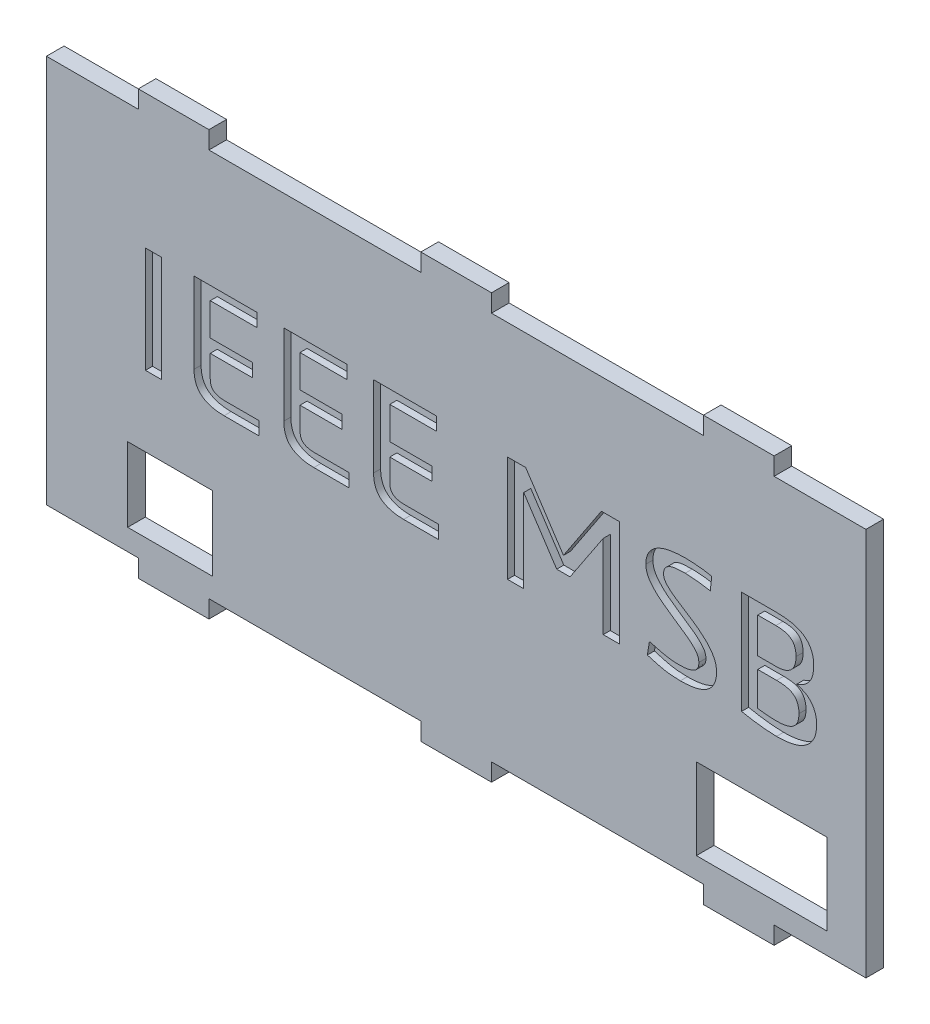
from build123d import *

# Parameters (mm, degrees)
SKETCH1_W           = 12
SKETCH1_H           = 10.5
SKETCH1_W_2         = 18.5
SKETCH1_H_2         = 11.5
BOSS_EXTRUDE1_DEPTH = 2.5
SKETCH2_W           = 2.291666667
SKETCH2_H           = 15
CUT_EXTRUDE1_DEPTH  = 1


with BuildPart() as part:
    # Sketch1 → Boss-Extrude1 (new body)
    with BuildSketch(Plane.XY):
        Polygon((-45, -30), (-35, -30), (-35, -27.5), (-5, -27.5), (-5, -30), (5, -30), (5, -27.5), (35, -27.5), (35, -30), (45, -30), (45, -27.5), (58, -27.5), (58, 27.5), (45, 27.5), (45, 30), (35, 30), (35, 27.5), (5, 27.5), (5, 30), (-5, 30), (-5, 27.5), (-35, 27.5), (-35, 30), (-45, 30), (-45, 27.5), (-58, 27.5), (-58, -27.5), (-45, -27.5), align=None)
        with Locations((-40.5, -19.25)):
            Rectangle(SKETCH1_W, SKETCH1_H, mode=Mode.SUBTRACT)
        with Locations((43.25, -18.75)):
            Rectangle(SKETCH1_W_2, SKETCH1_H_2, mode=Mode.SUBTRACT)
    extrude(amount=BOSS_EXTRUDE1_DEPTH)

    # Sketch2 → Cut-Extrude1 (cut)
    # profile 1 of 7: a face of its own
    with BuildSketch(Plane.XY.offset(2.5)):
        with Locations((-42.833333334, 3.5)):
            Rectangle(SKETCH2_W, SKETCH2_H)
    # profile 2 of 7: a face of its own
    with BuildSketch(Plane.XY.offset(2.5)):
        with BuildLine():
            Line((-28.194661458, 11), (-28.194661458, 9.125))
            Line((-28.194661458, 9.125), (-34.8125, 9.125))
            Line((-34.8125, 9.125), (-34.8125, 4.541666667))
            Line((-34.8125, 4.541666667), (-28.848958333, 4.541666667))
            Line((-28.848958333, 4.541666667), (-28.848958333, 2.666666667))
            Line((-28.848958333, 2.666666667), (-34.8125, 2.666666667))
            Line((-34.8125, 2.666666667), (-34.8125, -0.442057292))
            add(Edge.make_bspline(
                [(-34.8125, -0.442057292), (-34.810499584, -0.518088856), (-34.80662934, -0.66518864), (-34.780663549, -0.876603942), (-34.738954286, -1.069780939), (-34.680649072, -1.245349161), (-34.602636, -1.402028067), (-34.506532411, -1.540476285), (-34.395864041, -1.663673392), (-34.21662039, -1.798822172), (-33.95558579, -1.931839396), (-33.600741463, -2.046173424), (-33.198266319, -2.113369845), (-32.913891383, -2.121002854), (-32.764973958, -2.125)],
                knots=[0, 0, 0, 0, 0.897147799, 1.735729735, 2.509325195, 3.226042148, 3.913211409, 4.56675016, 5.210175516, 5.858171432, 7.204182463, 8.645714609, 10.243475498, 12, 12, 12, 12], degree=3))
            Line((-32.764973958, -2.125), (-27.904947917, -2.125))
            Line((-27.904947917, -2.125), (-27.904947917, -4))
            Line((-27.904947917, -4), (-32.852864583, -4))
            add(Edge.make_bspline(
                [(-32.852864583, -4), (-33.016773774, -3.997544016), (-33.335317899, -3.992771013), (-33.799986275, -3.954577847), (-34.235439235, -3.884766944), (-34.644890307, -3.796890155), (-35.022670985, -3.674410018), (-35.375187051, -3.53252437), (-35.697577169, -3.359187639), (-35.993313294, -3.161218378), (-36.256648285, -2.93117775), (-36.485869651, -2.670550433), (-36.677326863, -2.374947251), (-36.832074749, -2.048056487), (-36.957271456, -1.690519573), (-37.04357224, -1.300511014), (-37.096410836, -0.878634497), (-37.101523743, -0.586536108), (-37.104166667, -0.435546875)],
                knots=[0, 0, 0, 0, 1.238103223, 2.406152487, 3.517886997, 4.567837051, 5.565824166, 6.514104558, 7.434522606, 8.325680568, 9.196978744, 10.068276919, 10.938996607, 11.84817843, 12.79433104, 13.794503591, 14.859951901, 16, 16, 16, 16], degree=3))
            Line((-37.104166667, -0.435546875), (-37.104166667, 11))
            Line((-37.104166667, 11), (-28.194661458, 11))
        make_face()
    # profile 3 of 7: a face of its own
    with BuildSketch(Plane.XY.offset(2.5)):
        with BuildLine():
            Line((-15.486328125, 11), (-15.486328125, 9.125))
            Line((-15.486328125, 9.125), (-22.104166667, 9.125))
            Line((-22.104166667, 9.125), (-22.104166667, 4.541666667))
            Line((-22.104166667, 4.541666667), (-16.140625, 4.541666667))
            Line((-16.140625, 4.541666667), (-16.140625, 2.666666667))
            Line((-16.140625, 2.666666667), (-22.104166667, 2.666666667))
            Line((-22.104166667, 2.666666667), (-22.104166667, -0.442057292))
            add(Edge.make_bspline(
                [(-22.104166667, -0.442057292), (-22.102166251, -0.518088856), (-22.098296007, -0.66518864), (-22.072330216, -0.876603942), (-22.030620953, -1.069780939), (-21.972315739, -1.245349161), (-21.894302667, -1.402028067), (-21.798199078, -1.540476285), (-21.687530708, -1.663673392), (-21.508287056, -1.798822172), (-21.247252457, -1.931839396), (-20.892408129, -2.046173424), (-20.489932986, -2.113369845), (-20.20555805, -2.121002854), (-20.056640625, -2.125)],
                knots=[0, 0, 0, 0, 0.897147799, 1.735729735, 2.509325195, 3.226042148, 3.913211409, 4.56675016, 5.210175516, 5.858171432, 7.204182463, 8.645714609, 10.243475498, 12, 12, 12, 12], degree=3))
            Line((-20.056640625, -2.125), (-15.196614583, -2.125))
            Line((-15.196614583, -2.125), (-15.196614583, -4))
            Line((-15.196614583, -4), (-20.14453125, -4))
            add(Edge.make_bspline(
                [(-20.14453125, -4), (-20.308440441, -3.997544016), (-20.626984566, -3.992771013), (-21.091652942, -3.954577847), (-21.527105901, -3.884766944), (-21.936556974, -3.796890155), (-22.314337652, -3.674410018), (-22.666853718, -3.53252437), (-22.989243836, -3.359187639), (-23.284979961, -3.161218378), (-23.548314952, -2.93117775), (-23.777536318, -2.670550433), (-23.968993529, -2.374947251), (-24.123741416, -2.048056487), (-24.248938122, -1.690519573), (-24.335238906, -1.300511014), (-24.388077503, -0.878634497), (-24.393190409, -0.586536108), (-24.395833333, -0.435546875)],
                knots=[0, 0, 0, 0, 1.238103223, 2.406152487, 3.517886997, 4.567837051, 5.565824166, 6.514104558, 7.434522606, 8.325680568, 9.196978744, 10.068276919, 10.938996607, 11.84817843, 12.79433104, 13.794503591, 14.859951901, 16, 16, 16, 16], degree=3))
            Line((-24.395833333, -0.435546875), (-24.395833333, 11))
            Line((-24.395833333, 11), (-15.486328125, 11))
        make_face()
    # profile 4 of 7: a face of its own
    with BuildSketch(Plane.XY.offset(2.5)):
        with BuildLine():
            Line((-2.777994792, 11), (-2.777994792, 9.125))
            Line((-2.777994792, 9.125), (-9.395833333, 9.125))
            Line((-9.395833333, 9.125), (-9.395833333, 4.541666667))
            Line((-9.395833333, 4.541666667), (-3.432291667, 4.541666667))
            Line((-3.432291667, 4.541666667), (-3.432291667, 2.666666667))
            Line((-3.432291667, 2.666666667), (-9.395833333, 2.666666667))
            Line((-9.395833333, 2.666666667), (-9.395833333, -0.442057292))
            add(Edge.make_bspline(
                [(-9.395833333, -0.442057292), (-9.393832918, -0.518088856), (-9.389962674, -0.66518864), (-9.363996882, -0.876603942), (-9.32228762, -1.069780939), (-9.263982405, -1.245349161), (-9.185969333, -1.402028067), (-9.089865744, -1.540476285), (-8.979197375, -1.663673392), (-8.799953723, -1.798822172), (-8.538919124, -1.931839396), (-8.184074796, -2.046173424), (-7.781599653, -2.113369845), (-7.497224717, -2.121002854), (-7.348307292, -2.125)],
                knots=[0, 0, 0, 0, 0.897147799, 1.735729735, 2.509325195, 3.226042148, 3.913211409, 4.56675016, 5.210175516, 5.858171432, 7.204182463, 8.645714609, 10.243475498, 12, 12, 12, 12], degree=3))
            Line((-7.348307292, -2.125), (-2.48828125, -2.125))
            Line((-2.48828125, -2.125), (-2.48828125, -4))
            Line((-2.48828125, -4), (-7.436197917, -4))
            add(Edge.make_bspline(
                [(-7.436197917, -4), (-7.600107108, -3.997544016), (-7.918651232, -3.992771013), (-8.383319608, -3.954577847), (-8.818772568, -3.884766944), (-9.228223641, -3.796890155), (-9.606004319, -3.674410018), (-9.958520385, -3.53252437), (-10.280910502, -3.359187639), (-10.576646627, -3.161218378), (-10.839981618, -2.93117775), (-11.069202984, -2.670550433), (-11.260660196, -2.374947251), (-11.415408082, -2.048056487), (-11.540604789, -1.690519573), (-11.626905573, -1.300511014), (-11.67974417, -0.878634497), (-11.684857076, -0.586536108), (-11.6875, -0.435546875)],
                knots=[0, 0, 0, 0, 1.238103223, 2.406152487, 3.517886997, 4.567837051, 5.565824166, 6.514104558, 7.434522606, 8.325680568, 9.196978744, 10.068276919, 10.938996607, 11.84817843, 12.79433104, 13.794503591, 14.859951901, 16, 16, 16, 16], degree=3))
            Line((-11.6875, -0.435546875), (-11.6875, 11))
            Line((-11.6875, 11), (-2.777994792, 11))
        make_face()
    # profile 5 of 7: a face of its own
    with BuildSketch(Plane.XY.offset(2.5)):
        Polygon((9.842447917, 11), (15.1875, 2.901041667), (20.555338542, 11), (23.104166667, 11), (23.104166667, -4), (20.8125, -4), (20.8125, 7.796875), (16.118489583, 0.733072917), (14.233723958, 0.733072917), (9.5625, 7.796875), (9.5625, -4), (7.270833333, -4), (7.270833333, 11), align=None)
    # profile 6 of 7: a face of its own
    with BuildSketch(Plane.XY.offset(2.5)):
        with BuildLine():
            add(Edge.make_bspline(
                [(35.96875, 8.94921875), (35.847382499, 8.972939527), (35.585925852, 9.024040149), (35.169264003, 9.084231487), (34.717233417, 9.150496911), (34.244919389, 9.207151413), (33.764575384, 9.26140463), (33.290052344, 9.297900239), (32.83973213, 9.326328395), (32.550819065, 9.331082829), (32.4140625, 9.333333333)],
                knots=[0, 0, 0, 0, 0.829036243, 1.785956155, 2.822045536, 3.89228551, 4.975307857, 6.062841547, 7.083048955, 8, 8, 8, 8], degree=3))
            add(Edge.make_bspline(
                [(32.4140625, 9.333333333), (32.199183815, 9.331012657), (31.786327552, 9.326553835), (31.28309883, 9.293825898), (30.911256435, 9.244948734), (30.657538538, 9.199515352), (30.425508425, 9.128971154), (30.212423744, 9.048419264), (30.018729418, 8.953034686), (29.850019744, 8.831704342), (29.700103959, 8.69718945), (29.573887231, 8.541776869), (29.474690145, 8.36589022), (29.402261882, 8.167248908), (29.360209969, 7.944041658), (29.356235032, 7.787293409), (29.354166667, 7.705729167)],
                knots=[0, 0, 0, 0, 2.295489194, 4.410428573, 5.380894891, 6.301560079, 7.159764947, 7.966985716, 8.734184816, 9.457764993, 10.179765198, 10.880326743, 11.586237622, 12.32697511, 13.129438398, 14, 14, 14, 14], degree=3))
            add(Edge.make_bspline(
                [(29.354166667, 7.705729167), (29.361409468, 7.605005926), (29.376118975, 7.400445675), (29.488629947, 7.101368396), (29.665819964, 6.810691817), (29.911097634, 6.531289392), (30.204000994, 6.253994686), (30.538414987, 5.979622485), (30.902328744, 5.697829675), (31.447861052, 5.321604039), (32.186811584, 4.842443132), (33.111865491, 4.255167236), (34.043209124, 3.634444765), (34.772801435, 3.059465589), (35.313410904, 2.573778585), (35.678743368, 2.187278779), (36.010611128, 1.784701725), (36.307583482, 1.365582057), (36.550244164, 0.922952991), (36.731704873, 0.45492648), (36.831940297, -0.040674004), (36.846706755, -0.378707172), (36.854166667, -0.549479167)],
                knots=[0, 0, 0, 0, 0.519213468, 1.054477964, 1.630134935, 2.270161266, 2.967727746, 3.71175636, 4.503051278, 5.34407491, 7.13300234, 9.051150551, 11.003302341, 12.910294161, 13.842483047, 14.754150315, 15.653890787, 16.535313878, 17.40293064, 18.254252337, 19.118060482, 20, 20, 20, 20], degree=3))
            add(Edge.make_bspline(
                [(36.854166667, -0.549479167), (36.850010481, -0.710308216), (36.841966427, -1.021583471), (36.774091043, -1.470156947), (36.656825232, -1.881635704), (36.49247906, -2.254822843), (36.290223204, -2.593943308), (36.044880138, -2.896208503), (35.764847726, -3.168986089), (35.442389326, -3.401950674), (35.0876482, -3.607236234), (34.69435551, -3.77271382), (34.270086873, -3.918583958), (33.810585779, -4.026559046), (33.322906823, -4.105755653), (32.811234286, -4.164092155), (32.275699793, -4.200581421), (31.910649342, -4.205710343), (31.723958333, -4.208333333)],
                knots=[0, 0, 0, 0, 1.075194104, 2.080975546, 3.024934148, 3.928271024, 4.800677613, 5.657461563, 6.524782954, 7.407242198, 8.310928775, 9.259978089, 10.255920614, 11.308444205, 12.411965724, 13.558733007, 14.751507922, 16, 16, 16, 16], degree=3))
            add(Edge.make_bspline(
                [(31.723958333, -4.208333333), (31.49271859, -4.205710333), (31.03939084, -4.200568142), (30.372439233, -4.145297915), (29.731569538, -4.064481806), (29.122750848, -3.940488345), (28.549612072, -3.80351775), (28.015982838, -3.663284471), (27.523893527, -3.524673693), (27.212002358, -3.425698242), (27.0625, -3.378255208)],
                knots=[0, 0, 0, 0, 1.166641361, 2.287110747, 3.375174177, 4.42434953, 5.420457035, 6.34882319, 7.208522552, 8, 8, 8, 8], degree=3))
            Line((27.0625, -3.378255208), (27.352213542, -1.568359375))
            add(Edge.make_bspline(
                [(27.352213542, -1.568359375), (27.497525113, -1.609902248), (27.79848078, -1.695941941), (28.265908755, -1.822897344), (28.766670139, -1.948984452), (29.295302689, -2.081201198), (29.852052636, -2.198490499), (30.43335511, -2.272831053), (31.033996084, -2.324778683), (31.441722476, -2.330449305), (31.649088542, -2.333333333)],
                knots=[0, 0, 0, 0, 0.82784923, 1.714563499, 2.653014331, 3.656340952, 4.699592855, 5.767128945, 6.864381369, 8, 8, 8, 8], degree=3))
            add(Edge.make_bspline(
                [(31.649088542, -2.333333333), (31.836979159, -2.329020843), (32.196620654, -2.320766305), (32.710915631, -2.257022293), (33.172865014, -2.146594595), (33.523656266, -2.01930655), (33.767378623, -1.882819904), (33.927902101, -1.766298899), (34.057582548, -1.623331059), (34.168300512, -1.464601226), (34.252239064, -1.28504633), (34.310879512, -1.085267813), (34.346475988, -0.86758439), (34.351552178, -0.715632504), (34.354166667, -0.637369792)],
                knots=[0, 0, 0, 0, 1.865164993, 3.57011294, 5.132569067, 6.57499646, 7.255114939, 7.901464084, 8.534112646, 9.161604161, 9.81695743, 10.491765748, 11.223185006, 12, 12, 12, 12], degree=3))
            add(Edge.make_bspline(
                [(34.354166667, -0.637369792), (34.34676134, -0.522714063), (34.331878289, -0.292281691), (34.224876195, 0.047620316), (34.049090249, 0.3762764), (33.801811741, 0.689836602), (33.509540136, 0.998534112), (33.17762564, 1.305744295), (32.810497005, 1.611291511), (32.261807062, 2.017098091), (31.525949575, 2.529018518), (30.598587419, 3.131410735), (29.671897736, 3.759742714), (28.935450704, 4.31875263), (28.393945465, 4.791525532), (28.025958821, 5.154340942), (27.696811194, 5.530843674), (27.400416872, 5.912466984), (27.152719096, 6.31411637), (26.980322242, 6.743184453), (26.87516672, 7.195058502), (26.861247273, 7.503338834), (26.854166667, 7.66015625)],
                knots=[0, 0, 0, 0, 0.591380666, 1.188542884, 1.822507787, 2.505918877, 3.243027329, 4.015898054, 4.839248524, 5.707487546, 7.538026587, 9.466039613, 11.415971731, 13.317280673, 14.234172866, 15.125381555, 15.982728632, 16.814024653, 17.618094752, 18.409678073, 19.191027939, 20, 20, 20, 20], degree=3))
            add(Edge.make_bspline(
                [(26.854166667, 7.66015625), (26.860042308, 7.821058674), (26.87139753, 8.132017543), (26.951321774, 8.579286303), (27.093334117, 8.98455136), (27.286320652, 9.350420044), (27.531803457, 9.674110255), (27.813454582, 9.965008742), (28.131071384, 10.225194126), (28.490723647, 10.44648277), (28.884374669, 10.636539161), (29.310949798, 10.800747145), (29.769828366, 10.932531637), (30.259633226, 11.0358377), (30.773039972, 11.11182556), (31.306422466, 11.166074832), (31.854687579, 11.204622237), (32.226277086, 11.207087497), (32.4140625, 11.208333333)],
                knots=[0, 0, 0, 0, 1.03838471, 2.006774832, 2.919286264, 3.799627568, 4.665221273, 5.531947435, 6.40804449, 7.307755042, 8.250508454, 9.225938019, 10.254284747, 11.328399385, 12.454517948, 13.602227205, 14.788268378, 16, 16, 16, 16], degree=3))
            add(Edge.make_bspline(
                [(32.4140625, 11.208333333), (32.583364965, 11.206171732), (32.928663231, 11.20176307), (33.450709349, 11.17443366), (33.974707883, 11.135099832), (34.485813099, 11.089591364), (34.96953662, 11.041235914), (35.414245129, 10.974974268), (35.811431209, 10.90474054), (36.058934512, 10.851970405), (36.173828125, 10.827473958)],
                knots=[0, 0, 0, 0, 1.073469456, 2.189378298, 3.313843796, 4.405133658, 5.442979297, 6.395522168, 7.255184668, 8, 8, 8, 8], degree=3))
            Line((36.173828125, 10.827473958), (35.96875, 8.94921875))
        make_face()
    # profile 7 of 7: a face of its own
    with BuildSketch(Plane.XY.offset(2.5)):
        with BuildLine():
            add(Edge.make_bspline(
                [(45.252604167, 11), (45.453421212, 10.997709492), (45.846767377, 10.993223008), (46.421184198, 10.952122977), (46.967345759, 10.893579956), (47.481068949, 10.800858033), (47.964294805, 10.688583256), (48.406940853, 10.5341883), (48.812547931, 10.353100646), (49.176066224, 10.13370575), (49.500909376, 9.880621184), (49.791190229, 9.597451016), (50.035510648, 9.274340654), (50.244126891, 8.919451401), (50.406982016, 8.525207106), (50.524791536, 8.090216349), (50.591913464, 7.613426363), (50.599988459, 7.281680037), (50.604166667, 7.110026042)],
                knots=[0, 0, 0, 0, 1.275017476, 2.497413668, 3.655529886, 4.761172243, 5.810683038, 6.802155223, 7.733376211, 8.626736769, 9.490922873, 10.343577315, 11.193889908, 12.055407364, 12.951156235, 13.893904713, 14.910252681, 16, 16, 16, 16], degree=3))
            add(Edge.make_bspline(
                [(50.604166667, 7.110026042), (50.602363274, 6.986275454), (50.59887759, 6.747084485), (50.570043008, 6.398859263), (50.517933957, 6.073700654), (50.446880421, 5.769915605), (50.356295444, 5.4885178), (50.24428671, 5.229673542), (50.11665277, 4.990149629), (49.908899495, 4.709335488), (49.61133333, 4.392469992), (49.194881443, 4.069376848), (48.719368415, 3.801287998), (48.373168571, 3.673216891), (48.1953125, 3.607421875)],
                knots=[0, 0, 0, 0, 0.966624788, 1.868337948, 2.726741993, 3.536787614, 4.303406302, 5.032411389, 5.737978016, 6.417875256, 7.755106372, 9.120016348, 10.520442492, 12, 12, 12, 12], degree=3))
            add(Edge.make_bspline(
                [(48.1953125, 3.607421875), (48.375846164, 3.557556177), (48.740211622, 3.456913794), (49.173511914, 3.26376819), (49.509671093, 3.084002515), (49.746239638, 2.926048353), (49.963587311, 2.743041203), (50.166398762, 2.542445164), (50.348765952, 2.315173294), (50.515589549, 2.067598345), (50.6628224, 1.795127646), (50.789008558, 1.498782942), (50.895807456, 1.176350661), (50.969301171, 0.824879234), (51.010559972, 0.44434416), (51.017330729, 0.181959252), (51.020833333, 0.046223958)],
                knots=[0, 0, 0, 0, 1.581382182, 3.191654296, 3.996150086, 4.802578193, 5.590591429, 6.394825738, 7.209918391, 8.04941736, 8.915406058, 9.823505186, 10.769092598, 11.781910097, 12.852551823, 14, 14, 14, 14], degree=3))
            add(Edge.make_bspline(
                [(51.020833333, 0.046223958), (51.016417096, -0.122169436), (51.007834671, -0.449421654), (50.942637399, -0.924326387), (50.832049912, -1.367806005), (50.675525782, -1.781402811), (50.471699689, -2.164168804), (50.227169003, -2.51923734), (49.934565959, -2.839466269), (49.5985756, -3.128236334), (49.220163698, -3.385665742), (48.7964143, -3.608084754), (48.327468609, -3.792537255), (47.815283588, -3.944124854), (47.259488927, -4.06524123), (46.6586377, -4.146849558), (46.014223025, -4.200706794), (45.569561864, -4.205740316), (45.340494792, -4.208333333)],
                knots=[0, 0, 0, 0, 1.000984783, 1.945292987, 2.843427608, 3.713289463, 4.567532532, 5.41581069, 6.269858848, 7.138954811, 8.044381704, 8.985157295, 9.97829437, 11.035574772, 12.157986986, 13.356835235, 14.638374414, 16, 16, 16, 16], degree=3))
            add(Edge.make_bspline(
                [(45.340494792, -4.208333333), (45.175528279, -4.206242892), (44.828004462, -4.201839101), (44.281995546, -4.17051272), (43.685090046, -4.121118995), (42.824148127, -4.030184288), (41.719326837, -3.873763103), (40.836852296, -3.706157282), (40.395833333, -3.622395833)],
                knots=[0, 0, 0, 0, 0.595515751, 1.254532835, 1.973766876, 2.757598848, 4.379601532, 6, 6, 6, 6], degree=3))
            Line((40.395833333, -3.622395833), (40.395833333, 11))
            Line((40.395833333, 11), (45.252604167, 11))
        make_face()
        with BuildLine():
            add(Edge.make_bspline(
                [(42.6875, -2.115234375), (42.915134293, -2.1484352), (43.372593163, -2.215156308), (43.945450883, -2.272055977), (44.394307658, -2.299704464), (44.707654068, -2.321898307), (44.995385921, -2.330907198), (45.178816397, -2.332553989), (45.265625, -2.333333333)],
                knots=[0, 0, 0, 0, 1.598930811, 3.213246439, 3.999428574, 4.724909699, 5.396562606, 6, 6, 6, 6], degree=3))
            add(Edge.make_bspline(
                [(45.265625, -2.333333333), (45.414367115, -2.332083044), (45.699223799, -2.329688611), (46.107502027, -2.294519835), (46.479992464, -2.248916947), (46.816992392, -2.17833605), (47.119270798, -2.08257105), (47.389992911, -1.970932345), (47.627428113, -1.836568274), (47.832301169, -1.682278452), (48.005855743, -1.507734749), (48.153640585, -1.317620223), (48.27576459, -1.111568955), (48.367196934, -0.886014987), (48.432603207, -0.644826781), (48.48742501, -0.388828503), (48.515084192, -0.116064771), (48.518890696, 0.071131581), (48.520833333, 0.166666667)],
                knots=[0, 0, 0, 0, 1.5079511, 2.887883838, 4.153187438, 5.31219721, 6.37369912, 7.364942027, 8.276706912, 9.132853101, 9.957662229, 10.765486101, 11.569478376, 12.378725068, 13.225198586, 14.101406598, 15.031058665, 16, 16, 16, 16], degree=3))
            add(Edge.make_bspline(
                [(48.520833333, 0.166666667), (48.519297765, 0.267663153), (48.516316991, 0.463712862), (48.483623659, 0.748195378), (48.42781457, 1.012572849), (48.354354868, 1.258921042), (48.255526366, 1.484204922), (48.138572747, 1.691902647), (47.997212403, 1.878917657), (47.832659026, 2.046992363), (47.640218027, 2.197125081), (47.413215737, 2.322641869), (47.15336336, 2.430524472), (46.859542841, 2.516765051), (46.531862469, 2.584844594), (46.170627602, 2.632145665), (45.775016809, 2.661726754), (45.500056714, 2.664974314), (45.356770833, 2.666666667)],
                knots=[0, 0, 0, 0, 1.039457627, 2.017747073, 2.942324498, 3.818672792, 4.659186067, 5.469768499, 6.267391952, 7.065250057, 7.88532226, 8.770737444, 9.727160389, 10.776832741, 11.918314688, 13.169583561, 14.52502702, 16, 16, 16, 16], degree=3))
            Line((45.356770833, 2.666666667), (42.6875, 2.666666667))
            Line((42.6875, 2.666666667), (42.6875, -2.115234375))
        make_face(mode=Mode.SUBTRACT)
        with BuildLine():
            Line((42.6875, 4.333333333), (45.317708333, 4.333333333))
            add(Edge.make_bspline(
                [(45.317708333, 4.333333333), (45.42518282, 4.335188042), (45.634043308, 4.338792389), (45.93908527, 4.367312401), (46.22361298, 4.420407994), (46.491563067, 4.487098597), (46.739307963, 4.579798993), (46.970757845, 4.688382946), (47.181303148, 4.821341027), (47.375183869, 4.970809327), (47.548084731, 5.1427667), (47.696071515, 5.338878919), (47.823767809, 5.55459311), (47.928292079, 5.792697632), (48.004709858, 6.053584008), (48.06472665, 6.332922409), (48.09543109, 6.635180748), (48.10118931, 6.84304312), (48.104166667, 6.950520833)],
                knots=[0, 0, 0, 0, 1.179836879, 2.292835395, 3.358283882, 4.355062049, 5.319866689, 6.257597555, 7.156623973, 8.047803328, 8.940652974, 9.824557926, 10.737756677, 11.687217154, 12.670739226, 13.717376299, 14.819742255, 16, 16, 16, 16], degree=3))
            add(Edge.make_bspline(
                [(48.104166667, 6.950520833), (48.102662054, 7.053690504), (48.099755424, 7.252995011), (48.067105058, 7.540706435), (48.011905077, 7.805387233), (47.937100515, 8.047512671), (47.843958391, 8.269216878), (47.722897622, 8.464625006), (47.580265686, 8.636290212), (47.419189799, 8.788193432), (47.234404773, 8.920037312), (47.023310816, 9.030275665), (46.788426642, 9.123543125), (46.528709875, 9.203350416), (46.243665273, 9.258801967), (45.934010187, 9.301799499), (45.600248008, 9.327344963), (45.368749704, 9.331295665), (45.249348958, 9.333333333)],
                knots=[0, 0, 0, 0, 1.150697841, 2.222933009, 3.224930285, 4.163092118, 5.046954926, 5.900361047, 6.717263274, 7.53092952, 8.364087008, 9.241458692, 10.181181528, 11.180762319, 12.268199555, 13.417048986, 14.667781701, 16, 16, 16, 16], degree=3))
            Line((45.249348958, 9.333333333), (42.6875, 9.333333333))
            Line((42.6875, 9.333333333), (42.6875, 4.333333333))
        make_face(mode=Mode.SUBTRACT)
    extrude(amount=-CUT_EXTRUDE1_DEPTH, mode=Mode.SUBTRACT)


solid = part.part
